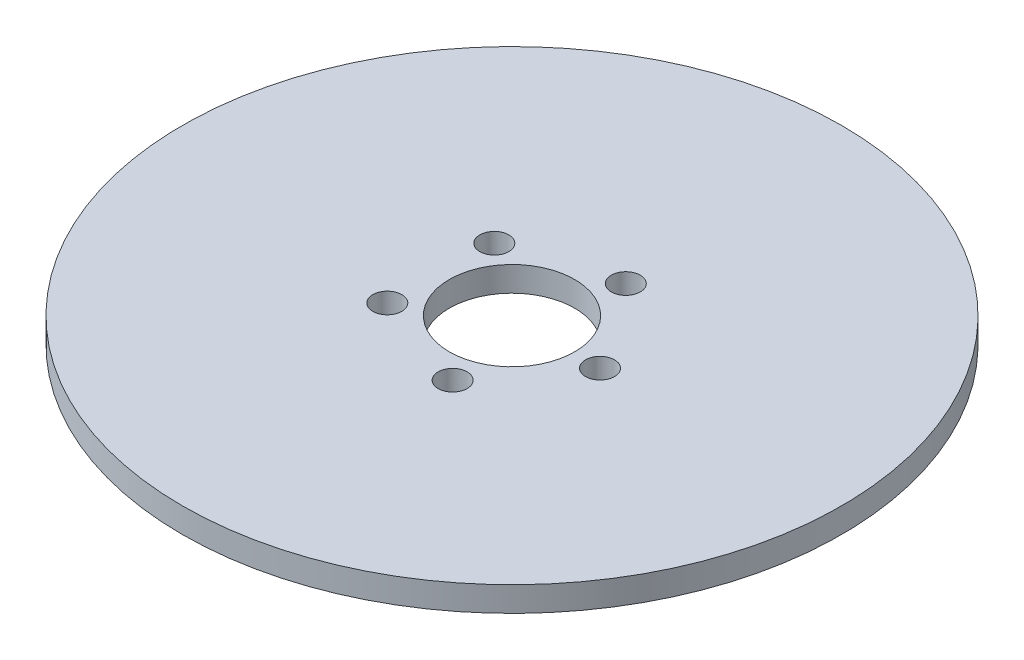
from build123d import *

# Parameters (mm, degrees)
SKETCH1_R           = 42.069665372
SKETCH1_R_2         = 8.001
SKETCH1_R_3         = 1.8542
BOSS_EXTRUDE1_DEPTH = 3.175


with BuildPart() as part:
    # Sketch1 → Boss-Extrude1 (new body)
    with BuildSketch(Plane(origin=(0, 1054.463973352, 0), x_dir=(-1, 0, 0), z_dir=(0, 1, 0))):
        with Locations((1.204093701, -633.11487505)):
            Circle(SKETCH1_R)
        with Locations((1.204093701, -633.11487505)):
            Circle(SKETCH1_R_2, mode=Mode.SUBTRACT)
        with Locations((10.336534073, -639.988260885)):
            Circle(SKETCH1_R_3, mode=Mode.SUBTRACT)
        with Locations((-2.510805411, -643.924335008)):
            Circle(SKETCH1_R_3, mode=Mode.SUBTRACT)
        with Locations((-10.224280588, -632.922102869)):
            Circle(SKETCH1_R_3, mode=Mode.SUBTRACT)
        with Locations((10.563151363, -626.553401155)):
            Circle(SKETCH1_R_3, mode=Mode.SUBTRACT)
        with Locations((-2.144130934, -622.186275332)):
            Circle(SKETCH1_R_3, mode=Mode.SUBTRACT)
    extrude(amount=-BOSS_EXTRUDE1_DEPTH)


solid = part.part
